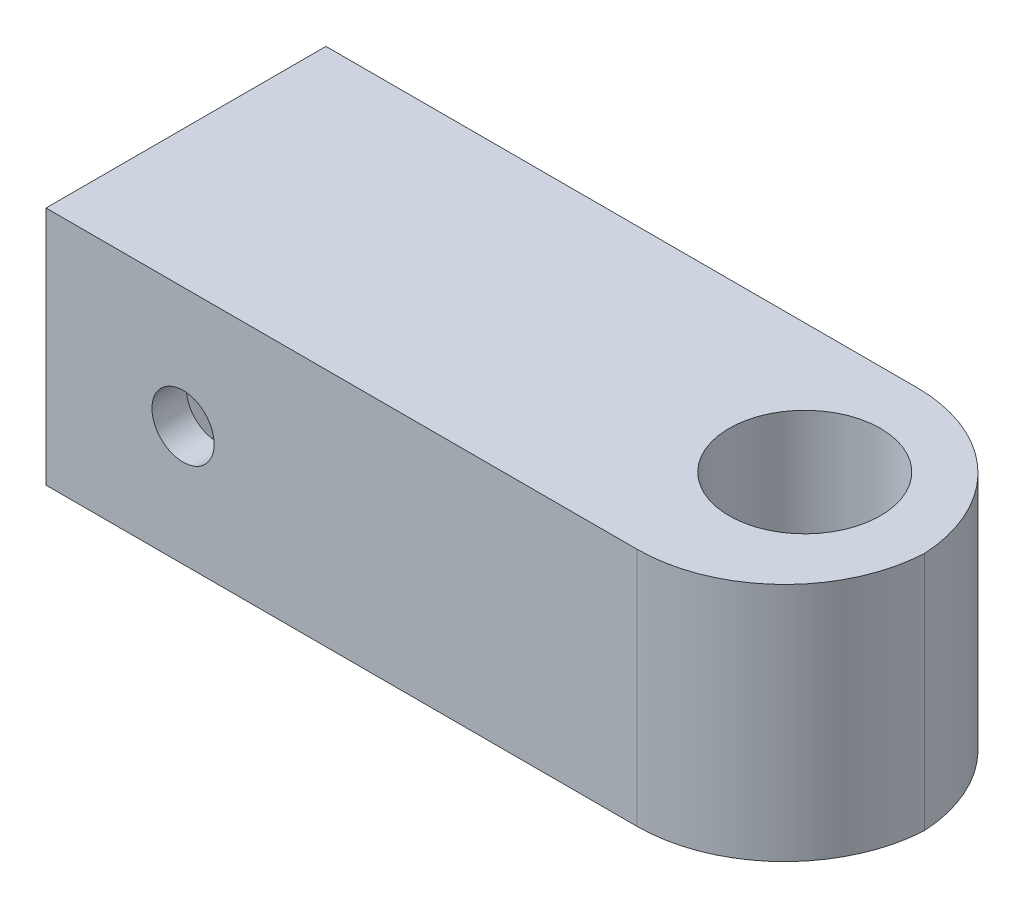
from build123d import *

# Parameters (mm, degrees)
ESBO_O2_R                = 4.1
RESSALTO_EXTRUS_O1_DEPTH = 13
ESBO_O3_W                = 7
ESBO_O3_H                = 7
CORTE_EXTRUS_O1_DEPTH    = 26
CORTE_EXTRUS_O2_DEPTH    = 2.8
ESBO_O10_R               = 1.683661958
CORTE_EXTRUS_O3_DEPTH    = 2.8
FILETE1_R                = 8


with BuildPart() as part:
    # Esboço2 → Ressalto-extrusão1 (new body)
    with BuildSketch(Plane(origin=(0, 0, 0), x_dir=(1, 0, 0), z_dir=(0, 1, 0))):
        Polygon((20, -5), (20, 7), (-20, 7), (-20, -5), (-20, -8.161034979), (20, -8.161034979), align=None)
        with Locations(Location((12.930574096, 0, 0), (0, 0, 90))):
            Circle(ESBO_O2_R, mode=Mode.SUBTRACT)
    extrude(amount=RESSALTO_EXTRUS_O1_DEPTH)

    # Esboço3 → Corte-extrusão1 (cut)
    with BuildSketch(Plane.ZY.offset(20)):
        with Locations((0, 6.5)):
            Rectangle(ESBO_O3_W, ESBO_O3_H)
    extrude(amount=-CORTE_EXTRUS_O1_DEPTH, mode=Mode.SUBTRACT)

    # Esboço7 → Corte-extrusão2 (cut)
    with BuildSketch(Plane(origin=(0, 0, 3.5), x_dir=(-1, 0, 0), z_dir=(0, 0, -1))):
        Polygon((8.882456985, 6.475905175), (10.729977846, 3.275905175), (14.425019569, 3.275905175), (16.272540431, 6.475905175), (14.425019569, 9.675905175), (10.729977846, 9.675905175), align=None)
    extrude(amount=-CORTE_EXTRUS_O2_DEPTH, mode=Mode.SUBTRACT)

    # Esboço10 → Corte-extrusão3 (cut)
    with BuildSketch(Plane(origin=(0, 0, 6.3), x_dir=(-1, 0, 0), z_dir=(0, 0, -1))):
        with Locations((12.577498708, 6.475905175)):
            Circle(ESBO_O10_R)
    extrude(amount=-CORTE_EXTRUS_O3_DEPTH, mode=Mode.SUBTRACT)

    # Filete1
    # the kernel refuses this fillet: 8 mm, written as the material it takes off along each edge
    with BuildSketch(Plane(origin=(20, -20, -7), x_dir=(0, 0, 1), z_dir=(0, 1, 0))) as filete1_piece_1:
        with BuildLine():
            CenterArc((FILETE1_R, -FILETE1_R), FILETE1_R, 90, 90)
            Line((0, -FILETE1_R), (0, 0))
            Line((0, 0), (FILETE1_R, 0))
        make_face()
    extrude(amount=53, mode=Mode.SUBTRACT)
    with BuildSketch(Plane(origin=(20, -20, 8.161034979), x_dir=(0, 0, -1), z_dir=(0, 1, 0))) as filete1_piece_2:
        with BuildLine():
            CenterArc((FILETE1_R, FILETE1_R), FILETE1_R, 180, 90)
            Line((0, FILETE1_R), (0, 0))
            Line((0, 0), (FILETE1_R, 0))
        make_face()
    extrude(amount=53, mode=Mode.SUBTRACT)


solid = part.part
